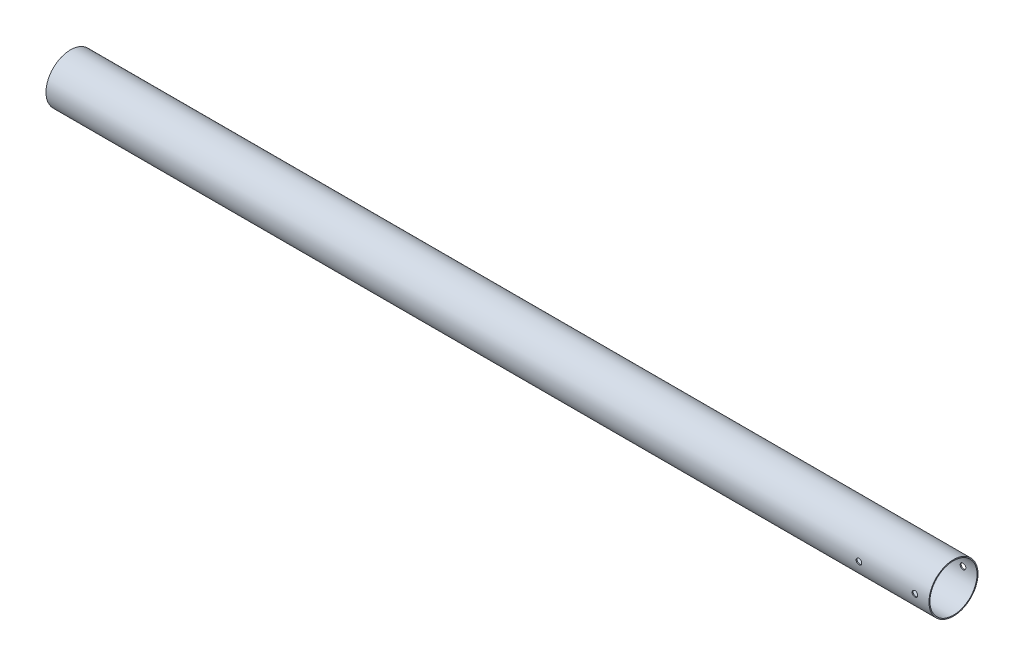
from build123d import *

# Parameters (mm, degrees)
SKETCH3_R               = 22.225
SKETCH3_R_2             = 21.336
BOSS_EXTRUDE1_DEPTH     = 400.05
CUT_EXTRUDE1_DEPTH      = 402.282822645
CUT_EXTRUDE1_DEPTH_BACK = 402.282822645
SKETCH4_R               = 2.5527


with BuildPart() as part:
    # Sketch3 → Boss-Extrude1 (new, symmetric)
    with BuildSketch(Plane(origin=(0, 0, 0), x_dir=(0, 0, -1), z_dir=(1, 0, 0))):
        Circle(SKETCH3_R)
        Circle(SKETCH3_R_2, mode=Mode.SUBTRACT)
    extrude(amount=BOSS_EXTRUDE1_DEPTH, both=True)

    # Sketch4 → Cut-Extrude1 (cut, two sides: drawn at the far end of the back side and taken through both)
    with BuildSketch(Plane.XY.offset(-CUT_EXTRUDE1_DEPTH_BACK)):
        with Locations((336.55, 0)):
            Circle(SKETCH4_R)
        with Locations((387.35, 0)):
            Circle(SKETCH4_R)
    extrude(amount=CUT_EXTRUDE1_DEPTH + CUT_EXTRUDE1_DEPTH_BACK, mode=Mode.SUBTRACT)


solid = part.part
